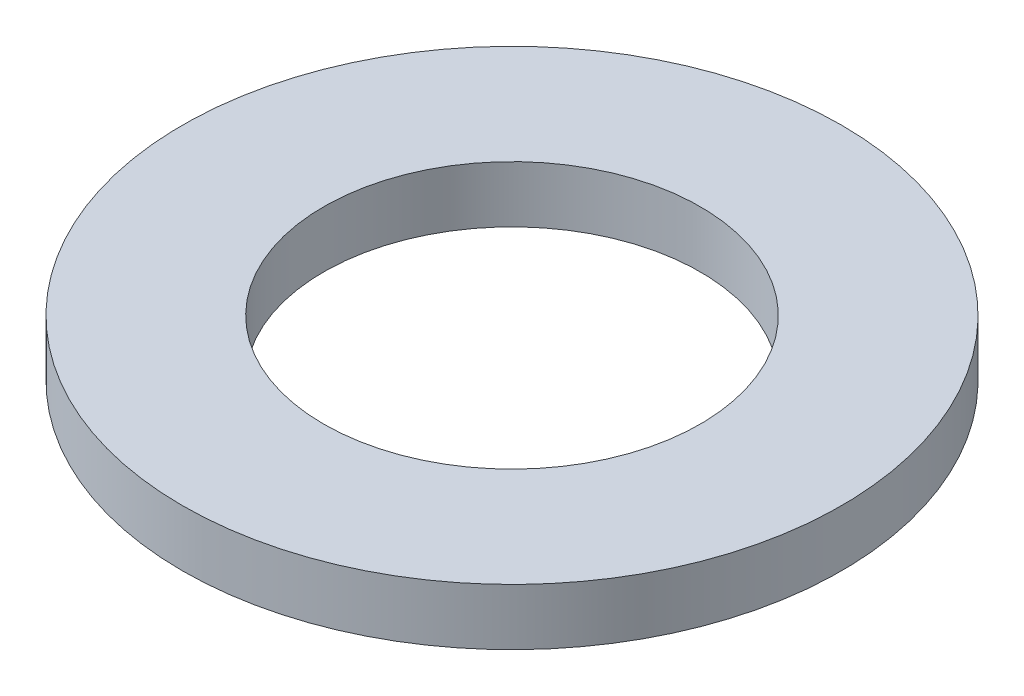
from build123d import *

# Parameters (mm, degrees)
SKETCH1_R           = 70
BOSS_EXTRUDE1_DEPTH = 12
SKETCH2_R           = 40
CUT_EXTRUDE1_DEPTH  = 100.719606899


with BuildPart() as part:
    # Sketch1 → Boss-Extrude1 (new body)
    with BuildSketch(Plane(origin=(0, 0, 0), x_dir=(1, 0, 0), z_dir=(0, 1, 0))):
        Circle(SKETCH1_R)
    extrude(amount=BOSS_EXTRUDE1_DEPTH)

    # Sketch2 → Cut-Extrude1 (cut, through all)
    with BuildSketch(Plane(origin=(0, 0, 0), x_dir=(1, 0, 0), z_dir=(0, 1, 0))):
        Circle(SKETCH2_R)
    extrude(amount=CUT_EXTRUDE1_DEPTH, mode=Mode.SUBTRACT)


solid = part.part
